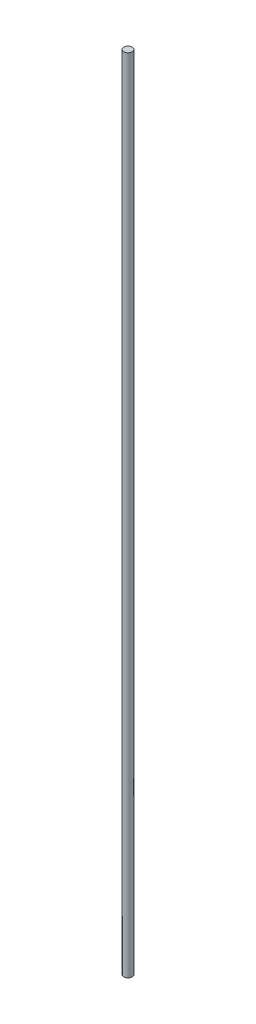
from build123d import *

# Parameters (mm, degrees)
SKETCH1_R           = 3.175
BOSS_EXTRUDE1_DEPTH = 609.6


with BuildPart() as part:
    # Sketch1 → Boss-Extrude1 (new body)
    with BuildSketch(Plane(origin=(0, 0, 0), x_dir=(1, 0, 0), z_dir=(0, 1, 0))):
        Circle(SKETCH1_R)
    extrude(amount=BOSS_EXTRUDE1_DEPTH)


solid = part.part
